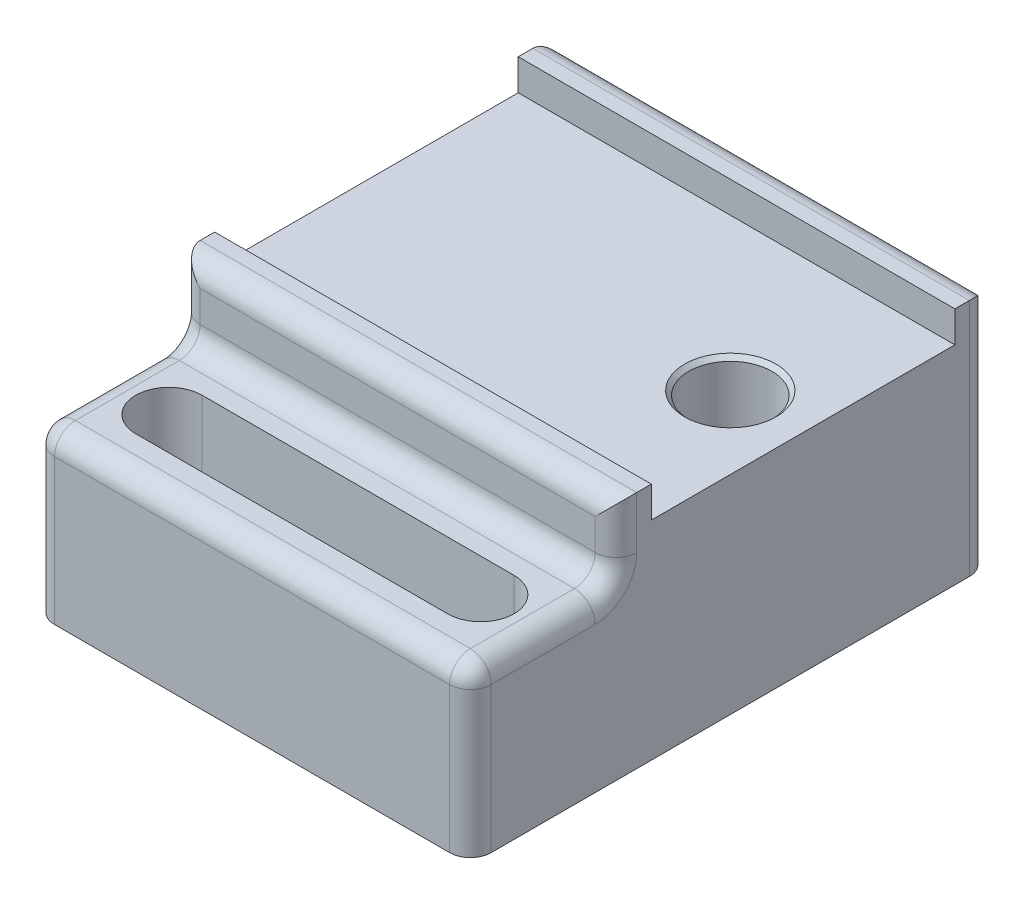
from build123d import *

# Parameters (mm, degrees)
SKETCH1_W           = 21
SKETCH1_H           = 14.6
BOSS_EXTRUDE1_DEPTH = 10
SKETCH1_3_W         = 21
SKETCH1_3_H         = 1.7
BOSS_EXTRUDE2_DEPTH = 11.5
SKETCH3_W           = 21
SKETCH3_H           = 7
BOSS_EXTRUDE4_DEPTH = 8
FILLET1_R           = 1
CUT_EXTRUDE1_DEPTH  = 21.742468513
SKETCH5_R           = 2
CUT_EXTRUDE2_DEPTH  = 6.8
CHAMFER1_SIZE       = 0.2


with BuildPart() as part:
    # Sketch1 → Boss-Extrude1 (new body)
    with BuildSketch(Plane(origin=(0, 0, 0), x_dir=(1, 0, 0), z_dir=(0, 1, 0))):
        Rectangle(SKETCH1_W, SKETCH1_H)
    extrude(amount=BOSS_EXTRUDE1_DEPTH)

    # Sketch1<3> → Boss-Extrude2 (add)
    with BuildSketch(Plane(origin=(0, 0, 0), x_dir=(1, 0, 0), z_dir=(0, 1, 0))):
        with Locations((0, 8.15)):
            Rectangle(SKETCH1_3_W, SKETCH1_3_H)
        with Locations((0, -8.15)):
            Rectangle(SKETCH1_3_W, SKETCH1_3_H)
    extrude(amount=BOSS_EXTRUDE2_DEPTH)

    # Sketch3 → Boss-Extrude4 (add)
    with BuildSketch(Plane(origin=(0, 0, 0), x_dir=(1, 0, 0), z_dir=(0, 1, 0))):
        with Locations((0, -12.5)):
            Rectangle(SKETCH3_W, SKETCH3_H)
    extrude(amount=BOSS_EXTRUDE4_DEPTH)

    # Fillet1
    fillet1_edges = [part.edges().sort_by_distance(p)[0] for p in [
        (10.5, 8, 12.5),
        (-10.5, 9.75, 9),
        (10.5, 5.75, -9),
        (0, 11.5, 9),
        (-10.5, 5.75, -9),
        (0, 11.5, -9),
        (-10.5, 4, 16),
        (10.5, 4, 16),
        (0, 8, 16),
        (10.5, 9.75, 9),
        (-10.5, 8, 12.5),
        (0, 8, 9),
    ]]
    fillet(fillet1_edges, radius=FILLET1_R)

    # Sketch4 → Cut-Extrude1 (cut, through all)
    with BuildSketch(Plane(origin=(0, 8, 0), x_dir=(1, 0, 0), z_dir=(0, 1, 0))):
        with BuildLine():
            Line((-7.5, -10.9), (7.5, -10.9))
            ThreePointArc((7.5, -10.9), (9.1, -12.5), (7.5, -14.1))
            Line((7.5, -14.1), (-7.5, -14.1))
            ThreePointArc((-7.5, -14.1), (-9.1, -12.5), (-7.5, -10.9))
        make_face()
    extrude(amount=-CUT_EXTRUDE1_DEPTH, mode=Mode.SUBTRACT)

    # Sketch5 → Cut-Extrude2 (cut)
    with BuildSketch(Plane(origin=(0, 10, 0), x_dir=(1, 0, 0), z_dir=(0, 1, 0))):
        with Locations((7, 0)):
            Circle(SKETCH5_R)
    extrude(amount=-CUT_EXTRUDE2_DEPTH, mode=Mode.SUBTRACT)

    # Chamfer1
    chamfer1_edges = [part.edges().sort_by_distance(p)[0] for p in [
        (5, 10, 0),
    ]]
    chamfer(chamfer1_edges, length=CHAMFER1_SIZE)


solid = part.part
